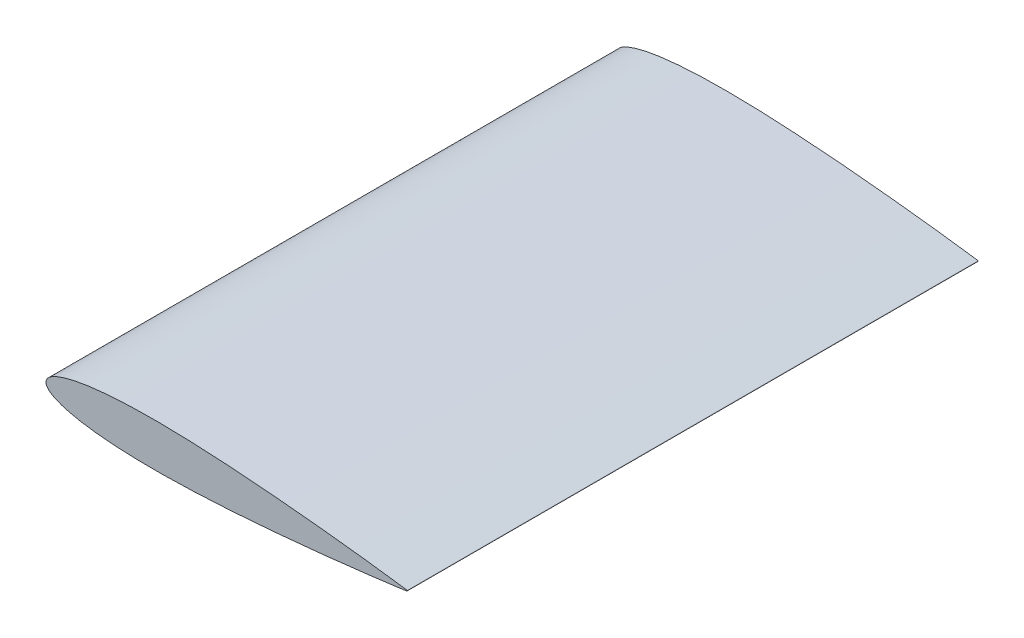
from build123d import *

# Parameters (mm, degrees)
BOSS_EXTRUDE1_DEPTH      = 180.721
BOSS_EXTRUDE1_DEPTH_BACK = 180.721


with BuildPart() as part:
    # Sketch1 → Boss-Extrude1 (new, two sides: drawn at the far end of the back side and taken through both)
    with BuildSketch(Plane.XY.offset(-BOSS_EXTRUDE1_DEPTH_BACK)):
        with BuildLine():
            add(Edge.make_bspline(
                [(-72.489557568, 12.491657943), (-72.489557568, 12.163179949), (-72.395425024, 11.48934067), (-71.973228769, 10.512610279), (-71.283304484, 9.572573657), (-70.334027276, 8.665150808), (-69.12846859, 7.787154489), (-67.668383782, 6.937745813), (-65.955909704, 6.117889867), (-63.994082603, 5.32944509), (-61.786794514, 4.574758302), (-59.3387566, 3.85635786), (-56.655356564, 3.176950344), (-53.742685567, 2.539002195), (-50.607371761, 1.945134105), (-47.256663108, 1.397506799), (-43.698292909, 0.898367729), (-39.940537725, 0.449401961), (-35.992130668, 0.052213203), (-31.862278617, -0.292093372), (-27.560604591, -0.582721332), (-23.097129806, -0.819182723), (-18.482275898, -1.001530379), (-13.726817418, -1.130105181), (-8.841852239, -1.205609716), (-3.838777395, -1.229212817), (1.270721946, -1.202325889), (6.474715491, -1.126707188), (11.761052083, -1.004405679), (17.117399344, -0.837746182), (22.531246658, -0.629162896), (27.989948369, -0.381339327), (33.480760297, -0.097088323), (38.990867431, 0.220726476), (44.507403086, 0.569152494), (50.01748413, 0.945227027), (55.50824848, 1.345997345), (60.966870643, 1.768459367), (66.380605649, 2.209786191), (71.736800946, 2.667094899), (77.022966891, 3.137613816), (82.226742233, 3.618637327), (87.335986279, 4.107466038), (92.33874929, 4.601612401), (97.22337044, 5.098509745), (101.97842058, 5.595742135), (106.592806113, 6.09086461), (111.055740441, 6.581468513), (115.356796488, 7.065355622), (119.485946029, 7.540067147), (123.433537168, 8.003395545), (127.190349685, 8.45306443), (130.74759876, 8.88685816), (134.096991185, 9.302502864), (137.230695421, 9.697903027), (140.141398454, 10.07084708), (142.822290249, 10.419416889), (145.267118152, 10.741489308), (147.470194704, 11.035274343), (149.426288026, 11.299112749), (151.131108503, 11.530867321), (152.579838286, 11.730782347), (153.771480415, 11.892674156), (154.69687643, 12.028725239), (155.369349103, 12.105914128), (155.755667825, 12.1894434), (156.151924325, 12.181894561), (156.151924325, 12.801421326), (155.755667825, 12.793872486), (155.369349103, 12.877401758), (154.69687643, 12.954590647), (153.771480415, 13.09064173), (152.579838286, 13.252533539), (151.131108503, 13.452448565), (149.426288026, 13.684203137), (147.470194704, 13.948041543), (145.267118152, 14.241826578), (142.822290249, 14.563898997), (140.141398454, 14.912468806), (137.230695421, 15.285412859), (134.096991185, 15.680813022), (130.74759876, 16.096457726), (127.190349685, 16.530251456), (123.433537168, 16.979920341), (119.485946029, 17.443248739), (115.356796488, 17.917960264), (111.055740441, 18.401847373), (106.592806113, 18.892451276), (101.97842058, 19.387573751), (97.22337044, 19.884806141), (92.33874929, 20.381703485), (87.335986279, 20.875849848), (82.226742233, 21.364678559), (77.022966891, 21.84570207), (71.736800946, 22.316220987), (66.380605649, 22.773529695), (60.966870643, 23.214856519), (55.50824848, 23.637318541), (50.01748413, 24.038088859), (44.507403086, 24.414163392), (38.990867431, 24.762589411), (33.480760297, 25.080404209), (27.989948369, 25.364655213), (22.531246658, 25.612478782), (17.117399344, 25.821062068), (11.761052083, 25.987721565), (6.474715491, 26.110023074), (1.270721946, 26.185641775), (-3.838777395, 26.212528703), (-8.841852239, 26.188925602), (-13.726817418, 26.113421067), (-18.482275898, 25.984846265), (-23.097129806, 25.80249861), (-27.560604591, 25.566037218), (-31.862278617, 25.275409258), (-35.992130668, 24.931102683), (-39.940537725, 24.533913925), (-43.698292909, 24.084948157), (-47.256663108, 23.585809087), (-50.607371761, 23.038181781), (-53.742685567, 22.444313691), (-56.655356564, 21.806365542), (-59.3387566, 21.126958026), (-61.786794514, 20.408557584), (-63.994082603, 19.653870796), (-65.955909704, 18.865426019), (-67.668383782, 18.045570073), (-69.12846859, 17.196161397), (-70.334027276, 16.318165078), (-71.283304484, 15.410742229), (-71.973228769, 14.470705607), (-72.395425024, 13.493975216), (-72.489557568, 12.820135937), (-72.489557568, 12.491657943)],
                knots=[0, 0, 0, 0, 0.002106168, 0.00432059, 0.006772783, 0.009556697, 0.012734041, 0.016342888, 0.020405604, 0.024934102, 0.029933071, 0.035402241, 0.04133743, 0.04773159, 0.054575389, 0.061857405, 0.069564571, 0.077682311, 0.086194684, 0.095084441, 0.104333244, 0.1139217, 0.123829339, 0.134034708, 0.144515531, 0.155248716, 0.166210356, 0.177375783, 0.188719821, 0.200216647, 0.211839951, 0.223562989, 0.235358653, 0.247199625, 0.259058395, 0.270907226, 0.282718457, 0.294464514, 0.306117689, 0.317650771, 0.329036618, 0.34024851, 0.351259999, 0.362045273, 0.372578891, 0.382836142, 0.392792739, 0.40242532, 0.411711115, 0.420628244, 0.429155673, 0.437273179, 0.444961561, 0.452202575, 0.458979063, 0.465274876, 0.471074963, 0.476365569, 0.481133961, 0.485368768, 0.489059784, 0.492198148, 0.494776266, 0.49678801, 0.498228425, 0.499094073, 0.499382862, 0.500617138, 0.500905927, 0.501771575, 0.50321199, 0.505223734, 0.507801852, 0.510940216, 0.514631232, 0.518866039, 0.523634431, 0.528925037, 0.534725124, 0.541020937, 0.547797425, 0.555038439, 0.562726821, 0.570844327, 0.579371756, 0.588288885, 0.59757468, 0.607207261, 0.617163858, 0.627421109, 0.637954727, 0.648740001, 0.65975149, 0.670963382, 0.682349229, 0.693882311, 0.705535486, 0.717281543, 0.729092774, 0.740941605, 0.752800375, 0.764641347, 0.776437011, 0.788160049, 0.799783353, 0.811280179, 0.822624217, 0.833789644, 0.844751284, 0.855484469, 0.865965292, 0.876170661, 0.8860783, 0.895666756, 0.904915559, 0.913805316, 0.922317689, 0.930435429, 0.938142595, 0.945424611, 0.95226841, 0.95866257, 0.964597759, 0.970066929, 0.975065898, 0.979594396, 0.983657112, 0.987265959, 0.990443303, 0.993227217, 0.99567941, 0.997893832, 1, 1, 1, 1], degree=3))
        make_face()
    extrude(amount=BOSS_EXTRUDE1_DEPTH + BOSS_EXTRUDE1_DEPTH_BACK)


solid = part.part
